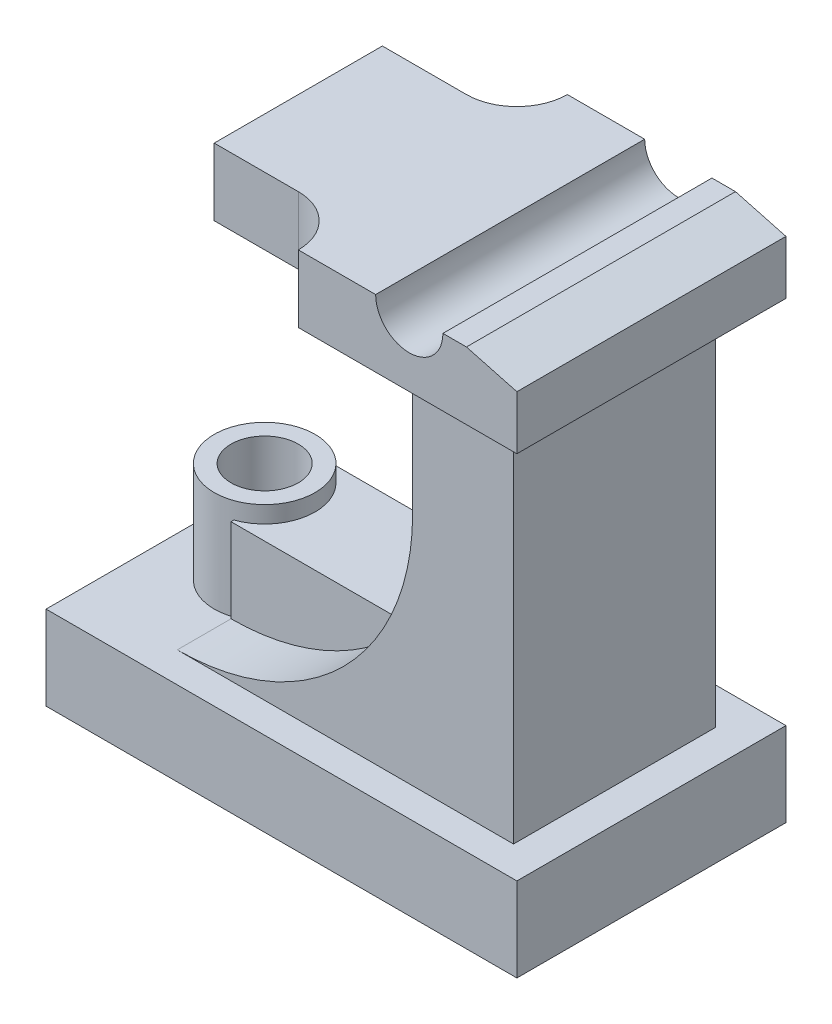
from build123d import *

# Parameters (mm, degrees)
SKETCH1_W           = 140
SKETCH1_H           = 80
BOSS_EXTRUDE1_DEPTH = 25
SKETCH2_W           = 30
SKETCH2_H           = 60
BOSS_EXTRUDE2_DEPTH = 110
FILLET1_R           = 70
BOSS_EXTRUDE4_DEPTH = 30
SKETCH6_W           = 105
SKETCH6_H           = 80
BOSS_EXTRUDE5_DEPTH = 20
CUT_EXTRUDE1_DEPTH  = 188.949461292
CHAMFER1_SIZE       = 15
CHAMFER1_SIZE2      = 4.019237886
BOSS_EXTRUDE8_DEPTH = 25
SKETCH14_W          = 40
SKETCH14_H          = 15
CUT_EXTRUDE4_DEPTH  = 20
FILLET2_R           = 15


with BuildPart() as part:
    # Sketch1 → Boss-Extrude1 (new body)
    with BuildSketch(Plane(origin=(0, 0, 0), x_dir=(1, 0, 0), z_dir=(0, 1, 0))):
        Rectangle(SKETCH1_W, SKETCH1_H)
    extrude(amount=BOSS_EXTRUDE1_DEPTH)

    # Sketch2 → Boss-Extrude2 (add)
    with BuildSketch(Plane(origin=(0, 25, 0), x_dir=(1, 0, 0), z_dir=(0, 1, 0))):
        with Locations((45, -1.000466796)):
            Rectangle(SKETCH2_W, SKETCH2_H)
    extrude(amount=BOSS_EXTRUDE2_DEPTH)

    # Fillet1
    fillet1_edges = [part.edges().sort_by_distance(p)[0] for p in [
        (30, 25, 1.000466796),
    ]]
    fillet(fillet1_edges, radius=FILLET1_R)

    # Sketch4 → Boss-Extrude4 (add)
    with BuildSketch(Plane(origin=(0, 25, 0), x_dir=(1, 0, 0), z_dir=(0, 1, 0))):
        with BuildLine():
            ThreePointArc((-40, 14.142135624), (-53.660254038, 12.247448714), (-60, 0))
            Line((-60, 0), (-55, 0))
            ThreePointArc((-55, 0), (-50, 8.660254038), (-40, 8.660254038))
            Line((-40, 8.660254038), (-40, 14.142135624))
        make_face()
        with BuildLine():
            Line((-55, 0), (-60, 0))
            ThreePointArc((-60, 0), (-53.660254038, -12.247448714), (-40, -14.142135624))
            Line((-40, -14.142135624), (-40, -8.660254038))
            ThreePointArc((-40, -8.660254038), (-50, -8.660254038), (-55, 0))
        make_face()
        with BuildLine():
            ThreePointArc((-30, 0), (-32.752551286, 8.660254038), (-40, 14.142135624))
            Line((-40, 14.142135624), (-40, 8.660254038))
            ThreePointArc((-40, 8.660254038), (-36.339745962, 5), (-35, 0))
            ThreePointArc((-35, 0), (-36.339745962, -5), (-40, -8.660254038))
            Line((-40, -8.660254038), (-40, -14.142135624))
            ThreePointArc((-40, -14.142135624), (-32.752551286, -8.660254038), (-30, 0))
        make_face()
    extrude(amount=BOSS_EXTRUDE4_DEPTH)

    # Sketch6 → Boss-Extrude5 (add)
    with BuildSketch(Plane(origin=(0, 135, 0), x_dir=(1, 0, 0), z_dir=(0, 1, 0))):
        with Locations((17.5, 0)):
            Rectangle(SKETCH6_W, SKETCH6_H)
    extrude(amount=BOSS_EXTRUDE5_DEPTH)

    # Sketch7 → Cut-Extrude1 (cut, through all)
    with BuildSketch(Plane.XY.offset(40)):
        with BuildLine():
            ThreePointArc((48, 155), (38, 165), (28, 155))
            Line((28, 155), (38, 155))
            Line((38, 155), (48, 155))
        make_face()
        with BuildLine():
            Line((38, 155), (28, 155))
            ThreePointArc((28, 155), (38, 145), (48, 155))
            Line((48, 155), (38, 155))
        make_face()
    extrude(amount=-CUT_EXTRUDE1_DEPTH, mode=Mode.SUBTRACT)

    # Chamfer1
    chamfer1_edges = [part.edges().sort_by_distance(p)[0] for p in [
        (70, 155, 0),
    ]]
    chamfer1_side = [part.faces().sort_by_distance(p)[0] for p in [
        (59, 155, 0),
    ]]
    chamfer(chamfer1_edges, length=CHAMFER1_SIZE, length2=CHAMFER1_SIZE2, reference=chamfer1_side[0])

    # Sketch13 → Boss-Extrude8 (add)
    with BuildSketch(Plane(origin=(0, 25, 0), x_dir=(1, 0, 0), z_dir=(0, 1, 0))):
        with BuildLine():
            Line((-40, -14.142135624), (-40, -15))
            Line((-40, -15), (16, -15))
            Line((16, -15), (16, 15))
            Line((16, 15), (-40, 15))
            Line((-40, 15), (-40, 14.142135624))
            ThreePointArc((-40, 14.142135624), (-32.752551286, 8.660254038), (-30, 0))
            ThreePointArc((-30, 0), (-32.752551286, -8.660254038), (-40, -14.142135624))
        make_face()
    extrude(amount=BOSS_EXTRUDE8_DEPTH)

    # Sketch14 → Cut-Extrude4 (cut)
    with BuildSketch(Plane(origin=(0, 155, 0), x_dir=(1, 0, 0), z_dir=(0, 1, 0))):
        with Locations((-15, 32.5)):
            Rectangle(SKETCH14_W, SKETCH14_H)
        with Locations((-15, -32.5)):
            Rectangle(SKETCH14_W, SKETCH14_H)
    extrude(amount=-CUT_EXTRUDE4_DEPTH, mode=Mode.SUBTRACT)

    # Fillet2
    fillet2_edges = [part.edges().sort_by_distance(p)[0] for p in [
        (5, 145, -25),
        (5, 145, 25),
    ]]
    fillet(fillet2_edges, radius=FILLET2_R - 0.0001)  # a hair under: the kernel refuses the full size


solid = part.part
